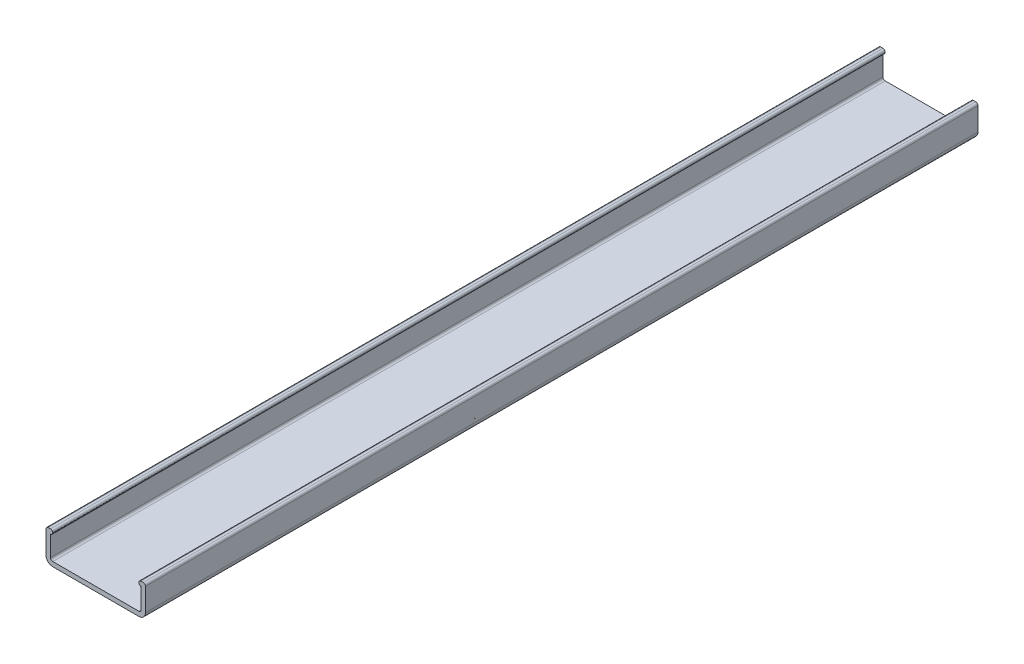
from build123d import *

# Parameters (mm, degrees)
BOSS_EXTRUDE1_DEPTH = 292.1
FILLET1_R           = 0.79375
FILLET2_R           = 2.3495


with BuildPart() as part:
    # Sketch1 → Boss-Extrude1 (new body)
    with BuildSketch(Plane.XY):
        Polygon((-17.4625, 11.1125), (-17.4625, 0), (17.4625, 0), (17.4625, 11.1125), (15.08125, 11.1125), (15.08125, 9.525), (15.875, 9.525), (15.875, 1.5875), (-15.875, 1.5875), (-15.875, 9.525), (-15.08125, 9.525), (-15.08125, 11.1125), align=None)
    extrude(amount=BOSS_EXTRUDE1_DEPTH)

    # Fillet1
    fillet1_edges = [part.edges().sort_by_distance(p)[0] for p in [
        (15.875, 1.5875, 146.05),
        (-15.875, 1.5875, 146.05),
        (-15.08125, 9.525, 146.05),
        (-15.08125, 11.1125, 146.05),
        (-17.4625, 11.1125, 146.05),
        (17.4625, 11.1125, 146.05),
        (15.08125, 11.1125, 146.05),
        (15.08125, 9.525, 146.05),
    ]]
    fillet(fillet1_edges, radius=FILLET1_R - 0.0001)  # a hair under: the kernel refuses the full size

    # Fillet2
    fillet2_edges = [part.edges().sort_by_distance(p)[0] for p in [
        (17.4625, 0, 146.05),
        (-17.4625, 0, 146.05),
    ]]
    fillet(fillet2_edges, radius=FILLET2_R)


solid = part.part
